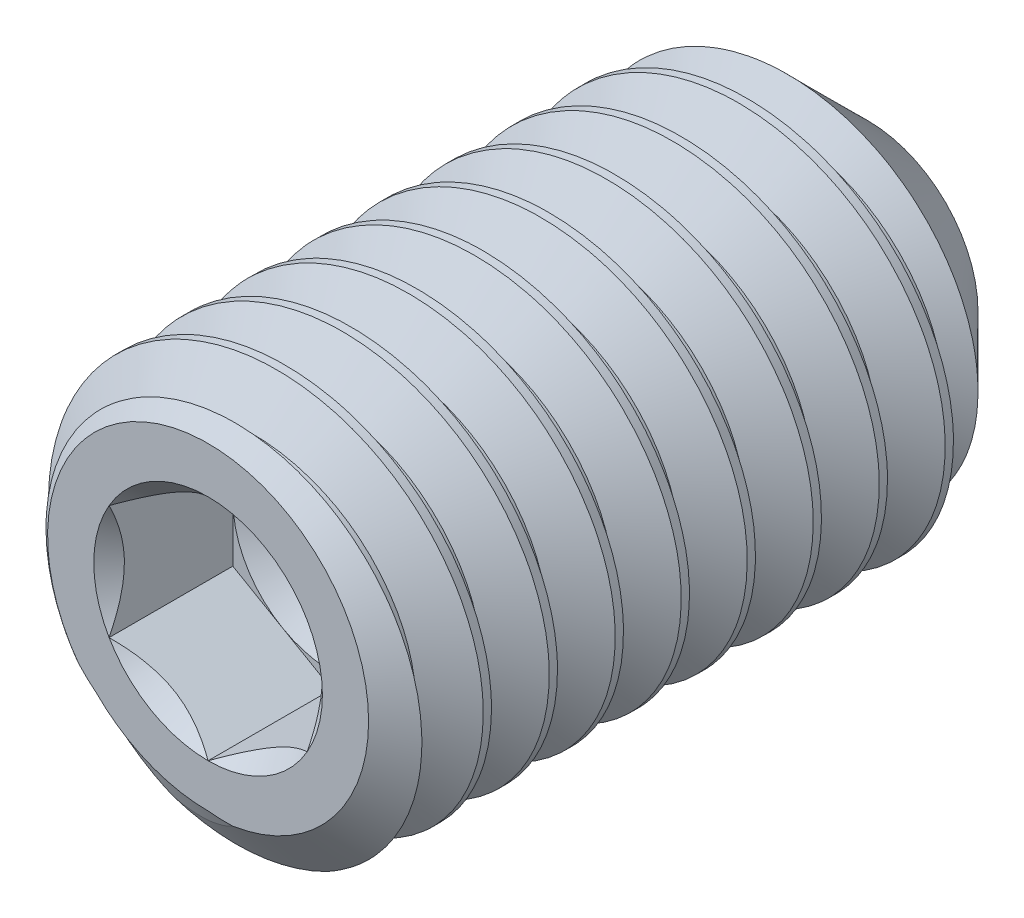
from build123d import *

# Parameters (mm, degrees)
CUT_EXTRUDE10_DEPTH = 1.48828125
CUT_SWEEP1_PITCH    = 0.79375


with BuildPart() as part:
    # Sketch22 → Revolve1 (revolve)
    with BuildSketch(Plane(origin=(0, 0, 0), x_dir=(0, 0, -1), z_dir=(1, 0, 0)), mode=Mode.PRIVATE) as revolve1_sk:
        Polygon((-3.571509232, 0), (-3.571509232, 1.9304), (-3.233589074, 2.413), (3.275230087, 2.413), (4.365990768, 1.322239319), (3.571509232, 0), align=None)
    revolve(revolve1_sk.sketch.rotate(Axis((0, 0, -3.571509232), (0, 0, -1)), 180), axis=Axis((0, 0, -3.571509232), (0, 0, -1)))

    # Sketch23 → Cut-Extrude10 (cut)
    with BuildSketch(Plane.XY.offset(3.571509232)):
        Polygon((0, 1.374815329), (-1.190625, 0.687407664), (-1.190625, -0.687407664), (0, -1.374815329), (1.190625, -0.687407664), (1.190625, 0.687407664), align=None)
    extrude(amount=-CUT_EXTRUDE10_DEPTH, mode=Mode.SUBTRACT)

    # Cut-Extrude11 cone 1 section (through the dimple's axis) → Cut-Extrude11 (revolve, cut)
    with BuildSketch(Plane(origin=(0, 0, 3.571509232), x_dir=(0, -1, 0), z_dir=(1, 0, 0))):
        Polygon((0, 0), (1.374815329, 0), (0, 1.374815329), align=None)
    revolve(axis=Axis((0, 0, 3.571509232), (0, 0, -1)), mode=Mode.SUBTRACT)

    # Cut-Extrude12 cone 1 section (through the dimple's axis) → Cut-Extrude12 (revolve, cut)
    with BuildSketch(Plane(origin=(0, 0, 2.083227982), x_dir=(0, -1, 0), z_dir=(1, 0, 0))):
        Polygon((0, 0), (1.190625, 0), (0, 0.687407664), align=None)
    revolve(axis=Axis((0, 0, 2.083227982), (0, 0, -1)), mode=Mode.SUBTRACT)

    # Cut-Sweep1: the profile of Sketch32 screwed along a right-hand helix of 11 turns, 8 arcs to a turn; built about Z, then put on its axis
    cut_sweep1_z = Axis((0, 0, 0), (0, 0, 1))
    cut_sweep1_corners = [(1.897444252, 0, -0.29765625), (1.897444252, 0, -0.396875), (2.455962979, 0, -0.719335937), (2.455962979, 0, 0.024804688)]
    with BuildLine(mode=Mode.PRIVATE) as cut_sweep1_profile:
        Line(cut_sweep1_corners[0], cut_sweep1_corners[1])
        Line(cut_sweep1_corners[1], cut_sweep1_corners[2])
        Line(cut_sweep1_corners[2], cut_sweep1_corners[3])
        Line(cut_sweep1_corners[3], cut_sweep1_corners[0])
    cut_sweep1_cap = Face(cut_sweep1_profile.wire())
    cut_sweep1_turn_angles = [0, 22.5, 45, 67.5, 90, 112.5, 135, 157.5, 180, 202.5, 225, 247.5, 270, 292.5, 315, 337.5, 360]
    cut_sweep1_turn_weights = [1, 0.9238795325112867, 1, 0.9238795325112867, 1, 0.9238795325112867, 1, 0.9238795325112867, 1, 0.9238795325112867, 1, 0.9238795325112867, 1, 0.9238795325112867, 1, 0.9238795325112867, 1]
    cut_sweep1_turn_rails = [Edge.make_bspline([Vector(p[0], p[1], 0).rotate(cut_sweep1_z, cut_sweep1_turn_angles[k]) / cut_sweep1_turn_weights[k] + Vector(0, 0, p[2] + CUT_SWEEP1_PITCH * cut_sweep1_turn_angles[k] / 360) for k in range(17)], [0, 0, 0, 1, 1, 2, 2, 3, 3, 4, 4, 5, 5, 6, 6, 7, 7, 8, 8, 8], 2, cut_sweep1_turn_weights) for p in cut_sweep1_corners]
    cut_sweep1_turn_sides = [Face.make_surface_from_curves(cut_sweep1_turn_rails[p[0]], cut_sweep1_turn_rails[p[1]]) for p in [(0, 1), (1, 2), (2, 3), (3, 0)]]
    cut_sweep1 = Plane(origin=(0, 0, -4.365990768), x_dir=(0, 1, 0), z_dir=(0, 0, 1)) * Solid(Shell([*[p.moved(Location((0, 0, CUT_SWEEP1_PITCH * i))) for i in range(11) for p in cut_sweep1_turn_sides], cut_sweep1_cap, cut_sweep1_cap.rotate(cut_sweep1_z, 3960).moved(Location((0, 0, CUT_SWEEP1_PITCH * 3960 / 360)))]))
    add(cut_sweep1, mode=Mode.SUBTRACT)


solid = part.part
